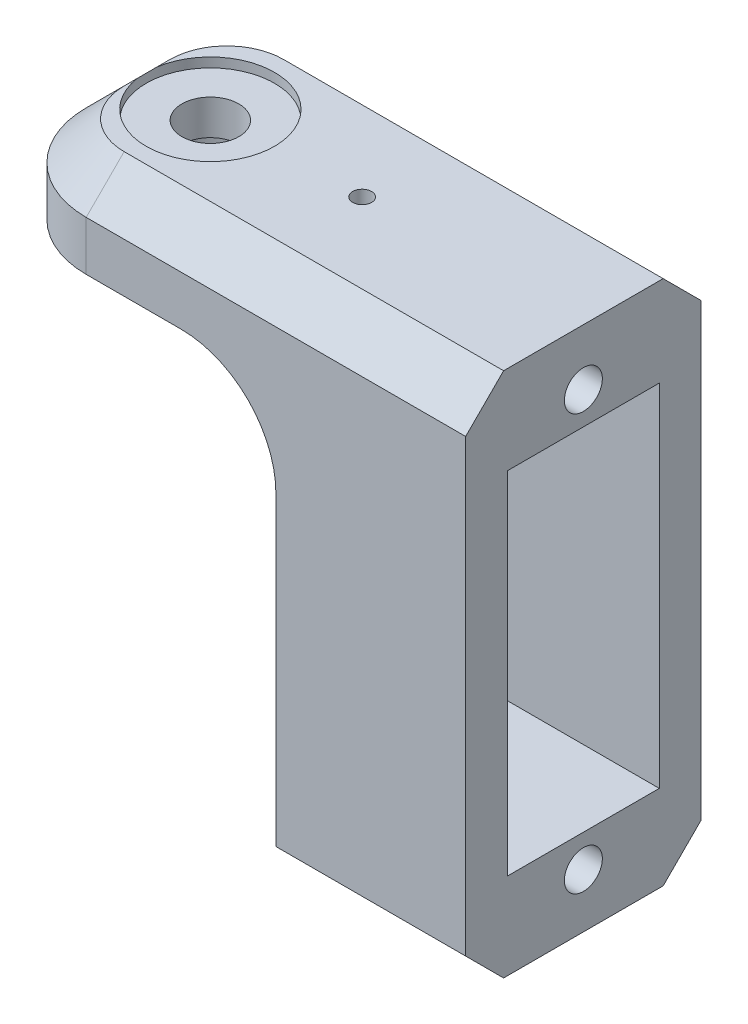
from build123d import *

# Parameters (mm, degrees)
SKETCH1_W               = 12.409227922
SKETCH1_H               = 27.718567262
SKETCH1_R               = 1
SKETCH1_W_2             = 8
SKETCH1_H_2             = 18.5
BOSS_EXTRUDE1_DEPTH     = 10
SKETCH6_W               = 12.409227922
SKETCH6_H               = 4.603346058
BOSS_EXTRUDE3_DEPTH     = 15
SKETCH7_R               = 3.1
CUT_EXTRUDE4_DEPTH      = 2.25
SKETCH8_W               = 11.323212184
SKETCH8_H               = 4
CUT_EXTRUDE5_DEPTH      = 1.25
CUT_EXTRUDE7_DEPTH      = 31.392767012
CUT_EXTRUDE7_DEPTH_BACK = 31.392767012
SKETCH9_R               = 1.5
SKETCH9_R_2             = 0.5
FILLET2_R               = 5
SKETCH10_R              = 3.380365375
CUT_EXTRUDE8_DEPTH      = 0.5
CHAMFER3_SIZE           = 2
FILLET3_R               = 5


with BuildPart() as part:
    # Sketch1 → Boss-Extrude1 (new body)
    with BuildSketch(Plane(origin=(0, 0, 0), x_dir=(0, 0, -1), z_dir=(1, 0, 0))):
        with Locations((1.233520205, 9.89974551)):
            Rectangle(SKETCH1_W, SKETCH1_H)
        with Locations((1.233520205, 20.798227972)):
            Circle(SKETCH1_R, mode=Mode.SUBTRACT)
        with Locations((1.233520205, -1.111772028)):
            Circle(SKETCH1_R, mode=Mode.SUBTRACT)
        with Locations((1.233520205, 9.843227972)):
            Rectangle(SKETCH1_W_2, SKETCH1_H_2, mode=Mode.SUBTRACT)
    extrude(amount=BOSS_EXTRUDE1_DEPTH)

    # Sketch6 → Boss-Extrude3 (add)
    with BuildSketch(Plane.ZY):
        with Locations((-1.233520205, 21.457356112)):
            Rectangle(SKETCH6_W, SKETCH6_H)
    extrude(amount=BOSS_EXTRUDE3_DEPTH)

    # Sketch7 → Cut-Extrude4 (cut)
    with BuildSketch(Plane.XZ.offset(-19.155683083)):
        with Locations(Location((-9.660045294, -1.233520205, 0), (0, 0, 270))):
            Circle(SKETCH7_R)
    extrude(amount=-CUT_EXTRUDE4_DEPTH, mode=Mode.SUBTRACT)

    # Sketch8 → Cut-Extrude5 (cut)
    with BuildSketch(Plane.XZ.offset(-19.155683083)):
        with Locations((-5.661606092, -1.303442539)):
            Rectangle(SKETCH8_W, SKETCH8_H)
    extrude(amount=-CUT_EXTRUDE5_DEPTH, mode=Mode.SUBTRACT)

    # Sketch9 → Cut-Extrude7 (cut, two sides: drawn at the far end of the back side and taken through both)
    with BuildSketch(Plane.XZ.offset(-21.405683083).offset(-CUT_EXTRUDE7_DEPTH_BACK)):
        with Locations(Location((-9.660045294, -1.233520205, 0), (0, 0, 270))):
            Circle(SKETCH9_R)
        with Locations(Location((-1.660045294, -1.233520205, 0), (0, 0, 270))):
            Circle(SKETCH9_R_2)
    extrude(amount=CUT_EXTRUDE7_DEPTH + CUT_EXTRUDE7_DEPTH_BACK, mode=Mode.SUBTRACT)

    # Fillet2
    fillet2_edges = [part.edges().sort_by_distance(p)[0] for p in [
        (-15, 21.457356112, -7.438134166),
        (-15, 21.457356112, 4.971093756),
    ]]
    fillet(fillet2_edges, radius=FILLET2_R)

    # Sketch10 → Cut-Extrude8 (cut)
    with BuildSketch(Plane(origin=(0, 23.759029141, 0), x_dir=(1, 0, 0), z_dir=(0, 1, 0))):
        with Locations(Location((-9.660045294, 1.233520205, 0), (0, 0, 270))):
            Circle(SKETCH10_R)
    extrude(amount=-CUT_EXTRUDE8_DEPTH, mode=Mode.SUBTRACT)

    # Chamfer3
    # the kernel refuses this chamfer: 2 mm, written as the material it takes off along each edge
    with BuildSketch(Plane(origin=(-5.143365976, -3.959538121, -7.438134166), x_dir=(0, 0.9996219169112968, -0.027495876610586487), z_dir=(1, 0, 0))) as chamfer3_piece_1:
        Polygon((CHAMFER3_SIZE * 0.999621916911, CHAMFER3_SIZE * 0.0274958766106), (-CHAMFER3_SIZE * 0.0274958766106, CHAMFER3_SIZE * 0.999621916911), (0, 0), align=None)
    extrude(amount=20.286731952, mode=Mode.SUBTRACT)
    with BuildSketch(Plane(origin=(-5.143365976, -3.959538121, 4.971093756), x_dir=(0, 0.9996219169112968, 0.027495876610586487), z_dir=(1, 0, 0))) as chamfer3_piece_2:
        Polygon((CHAMFER3_SIZE * 0.999621916911, -CHAMFER3_SIZE * 0.0274958766106), (-CHAMFER3_SIZE * 0.0274958766106, -CHAMFER3_SIZE * 0.999621916911), (0, 0), align=None)
    extrude(amount=20.286731952, mode=Mode.SUBTRACT)
    with BuildSketch(Plane(origin=(-10, 23.759029141, 4.971093756), x_dir=(0, 0.02749587661058563, -0.9996219169112968), z_dir=(1, 0, 0)), Plane(origin=(15.143365976, 23.759029141, -7.438134166), x_dir=(0, 0.027495876610585623, 0.9996219169112968), z_dir=(-1, 0, 0))) as chamfer3_piece_3:
        Polygon((CHAMFER3_SIZE * 0.999621916911, -CHAMFER3_SIZE * 0.0274958766106), (-CHAMFER3_SIZE * 0.0274958766106, -CHAMFER3_SIZE * 0.999621916911), (0, 0), align=None)
    extrude(amount=25.143365976, mode=Mode.SUBTRACT)
    with BuildSketch(Plane(origin=(-15, 23.759029141, -2.438134166), x_dir=(0.9996219169112968, 0.027495876610585623, 0), z_dir=(0, 0, 1))) as chamfer3_piece_4:
        Polygon((CHAMFER3_SIZE * 0.999621916911, -CHAMFER3_SIZE * 0.0274958766106), (-CHAMFER3_SIZE * 0.0274958766106, -CHAMFER3_SIZE * 0.999621916911), (0, 0), align=None)
    extrude(amount=2.409227923, mode=Mode.SUBTRACT)
    with BuildSketch(Plane(origin=(-10, 23.759029141, -0.028906244), x_dir=(-1, 0, 0), z_dir=(0, 0, -1))) as chamfer3_piece_5:
        Polygon((5 - CHAMFER3_SIZE, 0), (5, -CHAMFER3_SIZE), (5, 0), align=None)
    revolve(axis=Axis((-10, 23.759029141, -0.028906244), (0, 1, 0)), revolution_arc=90, mode=Mode.SUBTRACT)
    with BuildSketch(Plane(origin=(-10, 23.759029141, -2.438134166), x_dir=(-1, 0, 0), z_dir=(0, 0, 1))) as chamfer3_piece_6:
        Polygon((5 - CHAMFER3_SIZE, 0), (5, CHAMFER3_SIZE), (5, 0), align=None)
    revolve(axis=Axis((-10, 23.759029141, -2.438134166), (0, -1, 0)), revolution_arc=90, mode=Mode.SUBTRACT)

    # Fillet3
    # the kernel refuses this fillet: 5 mm, written as the material it adds along each edge
    with BuildSketch(Plane(origin=(0, 19.155683083, 9.196557461), x_dir=(-1, 0, 0), z_dir=(0, 0, -1))) as fillet3_piece_1_section:
        with BuildLine():
            CenterArc((FILLET3_R, -FILLET3_R), FILLET3_R, 90, 90)
            Line((0, -FILLET3_R), (0, 0))
            Line((0, 0), (FILLET3_R, 0))
        make_face()
    fillet3_piece_1 = extrude(amount=29.134691627, mode=Mode.PRIVATE)
    fillet3_piece_1 = split(fillet3_piece_1, bisect_by=Plane(origin=(-2.240914142, 19.125188019, 4.971093756), z_dir=(0, 0, -1)), keep=Keep.TOP, mode=Mode.PRIVATE)
    fillet3_piece_1 = split(fillet3_piece_1, bisect_by=Plane(origin=(-2.240914142, 19.093227972, 3.868786776), z_dir=(0, 1, 0)), keep=Keep.TOP, mode=Mode.PRIVATE)
    fillet3_piece_1 = split(fillet3_piece_1, bisect_by=Plane(origin=(-2.240914142, 19.125188019, 0.696557461), z_dir=(0, 0, 1)), keep=Keep.TOP, mode=Mode.PRIVATE)
    add(fillet3_piece_1)
    with BuildSketch(Plane(origin=(0, 19.155683083, 9.196557461), x_dir=(-1, 0, 0), z_dir=(0, 0, -1))) as fillet3_piece_2_section:
        with BuildLine():
            CenterArc((FILLET3_R, -FILLET3_R), FILLET3_R, 90, 90)
            Line((0, -FILLET3_R), (0, 0))
            Line((0, 0), (FILLET3_R, 0))
        make_face()
    fillet3_piece_2 = extrude(amount=29.134691627, mode=Mode.PRIVATE)
    fillet3_piece_2 = split(fillet3_piece_2, bisect_by=Plane(origin=(-1.055076688, 17.979153471, 4.971093756), z_dir=(0, 0, -1)), keep=Keep.TOP, mode=Mode.PRIVATE)
    fillet3_piece_2 = split(fillet3_piece_2, bisect_by=Plane(origin=(-1.055076688, 17.979153471, 2.766479795), z_dir=(0, 0, 1)), keep=Keep.TOP, mode=Mode.PRIVATE)
    add(fillet3_piece_2)
    with BuildSketch(Plane(origin=(0, 19.155683083, -3.303442539), x_dir=(-1, 0, 0), z_dir=(0, 0, -1))) as fillet3_piece_3_section:
        with BuildLine():
            CenterArc((FILLET3_R, -FILLET3_R), FILLET3_R, 90, 90)
            Line((0, -FILLET3_R), (0, 0))
            Line((0, 0), (FILLET3_R, 0))
        make_face()
    fillet3_piece_3 = extrude(amount=4.134691627, mode=Mode.PRIVATE)
    fillet3_piece_3 = split(fillet3_piece_3, bisect_by=Plane(origin=(-2.240914142, 19.093227972, -4.268481372), z_dir=(0, 1, 0)), keep=Keep.TOP, mode=Mode.PRIVATE)
    add(fillet3_piece_3)
    with BuildSketch(Plane(origin=(0, 19.155683083, 9.196557461), x_dir=(-1, 0, 0), z_dir=(0, 0, -1))) as fillet3_piece_4_section:
        with BuildLine():
            CenterArc((FILLET3_R, -FILLET3_R), FILLET3_R, 90, 90)
            Line((0, -FILLET3_R), (0, 0))
            Line((0, 0), (FILLET3_R, 0))
        make_face()
    fillet3_piece_4 = extrude(amount=16.634691627, mode=Mode.PRIVATE)
    fillet3_piece_4 = split(fillet3_piece_4, bisect_by=Plane(origin=(-1.055076688, 17.979153471, -5.233520205), z_dir=(0, 0, -1)), keep=Keep.TOP, mode=Mode.PRIVATE)
    add(fillet3_piece_4)
    with BuildSketch(Plane(origin=(0, 19.155683083, 4.971093756), x_dir=(-1, 0, 0), z_dir=(0, 0, -1))) as fillet3_piece_5_section:
        with BuildLine():
            CenterArc((FILLET3_R, -FILLET3_R), FILLET3_R, 90, 90)
            Line((0, -FILLET3_R), (0, 0))
            Line((0, 0), (FILLET3_R, 0))
        make_face()
    fillet3_piece_5 = extrude(amount=4.274536296, mode=Mode.PRIVATE)
    fillet3_piece_5 = split(fillet3_piece_5, bisect_by=Plane(origin=(-2.240914142, 19.093227972, 3.868786776), z_dir=(0, 1, 0)), keep=Keep.TOP, mode=Mode.PRIVATE)
    add(fillet3_piece_5)
    with BuildSketch(Plane(origin=(0, 19.155683083, 4.971093756), x_dir=(-1, 0, 0), z_dir=(0, 0, -1))) as fillet3_piece_6_section:
        with BuildLine():
            CenterArc((FILLET3_R, -FILLET3_R), FILLET3_R, 90, 90)
            Line((0, -FILLET3_R), (0, 0))
            Line((0, 0), (FILLET3_R, 0))
        make_face()
    fillet3_piece_6 = extrude(amount=16.774536296, mode=Mode.PRIVATE)
    fillet3_piece_6 = split(fillet3_piece_6, bisect_by=Plane(origin=(-1.055076688, 17.979153471, 2.766479795), z_dir=(0, 0, 1)), keep=Keep.TOP, mode=Mode.PRIVATE)
    add(fillet3_piece_6)
    with BuildSketch(Plane(origin=(0, 19.155683083, 17.471093756), x_dir=(-1, 0, 0), z_dir=(0, 0, -1))) as fillet3_piece_7_section:
        with BuildLine():
            CenterArc((FILLET3_R, -FILLET3_R), FILLET3_R, 90, 90)
            Line((0, -FILLET3_R), (0, 0))
            Line((0, 0), (FILLET3_R, 0))
        make_face()
    fillet3_piece_7 = extrude(amount=29.274536296, mode=Mode.PRIVATE)
    fillet3_piece_7 = split(fillet3_piece_7, bisect_by=Plane(origin=(-2.240914142, 19.125188019, -7.438134166), z_dir=(0, 0, 1)), keep=Keep.TOP, mode=Mode.PRIVATE)
    fillet3_piece_7 = split(fillet3_piece_7, bisect_by=Plane(origin=(-2.240914142, 19.093227972, -4.268481372), z_dir=(0, 1, 0)), keep=Keep.TOP, mode=Mode.PRIVATE)
    fillet3_piece_7 = split(fillet3_piece_7, bisect_by=Plane(origin=(-2.240914142, 19.125188019, -3.303442539), z_dir=(0, 0, -1)), keep=Keep.TOP, mode=Mode.PRIVATE)
    add(fillet3_piece_7)
    with BuildSketch(Plane(origin=(0, 19.155683083, 17.471093756), x_dir=(-1, 0, 0), z_dir=(0, 0, -1))) as fillet3_piece_8_section:
        with BuildLine():
            CenterArc((FILLET3_R, -FILLET3_R), FILLET3_R, 90, 90)
            Line((0, -FILLET3_R), (0, 0))
            Line((0, 0), (FILLET3_R, 0))
        make_face()
    fillet3_piece_8 = extrude(amount=29.274536296, mode=Mode.PRIVATE)
    fillet3_piece_8 = split(fillet3_piece_8, bisect_by=Plane(origin=(-1.055076688, 17.979153471, -7.438134166), z_dir=(0, 0, 1)), keep=Keep.TOP, mode=Mode.PRIVATE)
    fillet3_piece_8 = split(fillet3_piece_8, bisect_by=Plane(origin=(-1.055076688, 17.979153471, -5.233520205), z_dir=(0, 0, -1)), keep=Keep.TOP, mode=Mode.PRIVATE)
    add(fillet3_piece_8)


solid = part.part
